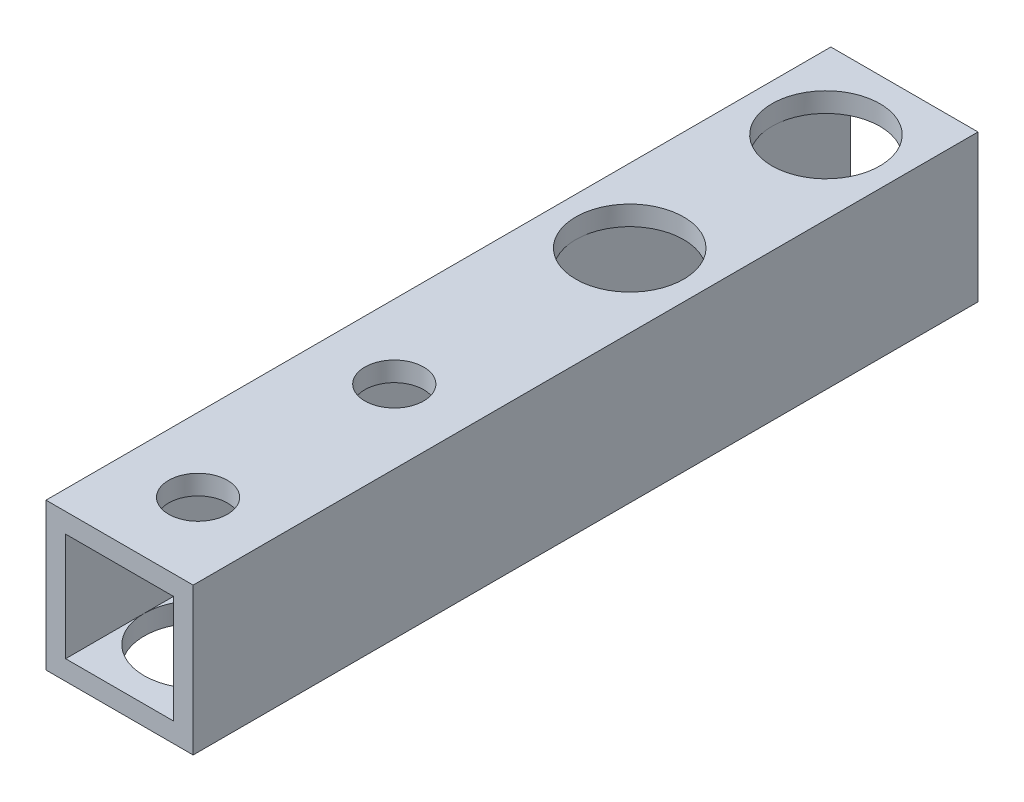
from build123d import *

# Parameters (mm, degrees)
ESQUISSE1_W             = 7.5
ESQUISSE1_H             = 7.5
ESQUISSE1_W_2           = 5.5
ESQUISSE1_H_2           = 5.5
BOSS_EXTRU_1_DEPTH      = 40
ESQUISSE2_R             = 1.5
ENL_V_MAT_EXTRU_1_DEPTH = 41.869456811
ESQUISSE3_R             = 2.75
ENL_V_MAT_EXTRU_2_DEPTH = 2
ESQUISSE4_R             = 2.75
ENL_V_MAT_EXTRU_3_DEPTH = 2


with BuildPart() as part:
    # Esquisse1 → Boss.-Extru.1 (new body)
    with BuildSketch(Plane.XY):
        Rectangle(ESQUISSE1_W, ESQUISSE1_H)
        Rectangle(ESQUISSE1_W_2, ESQUISSE1_H_2, mode=Mode.SUBTRACT)
    extrude(amount=BOSS_EXTRU_1_DEPTH)

    # Esquisse2 → Enlèv. mat.-Extru.1 (cut, through all)
    with BuildSketch(Plane(origin=(0, 3.75, 0), x_dir=(1, 0, 0), z_dir=(0, 1, 0))):
        with Locations((0, -4)):
            Circle(ESQUISSE2_R)
        with Locations((0, -14)):
            Circle(ESQUISSE2_R)
        with Locations((0, -26)):
            Circle(ESQUISSE2_R)
        with Locations((0, -36)):
            Circle(ESQUISSE2_R)
    extrude(amount=-ENL_V_MAT_EXTRU_1_DEPTH, mode=Mode.SUBTRACT)

    # Esquisse3 → Enlèv. mat.-Extru.2 (cut)
    with BuildSketch(Plane(origin=(0, 3.75, 0), x_dir=(1, 0, 0), z_dir=(0, 1, 0))):
        with Locations((0, -4)):
            Circle(ESQUISSE3_R)
        with Locations((0, -14)):
            Circle(ESQUISSE3_R)
    extrude(amount=-ENL_V_MAT_EXTRU_2_DEPTH, mode=Mode.SUBTRACT)

    # Esquisse4 → Enlèv. mat.-Extru.3 (cut)
    with BuildSketch(Plane.XZ.offset(3.75)):
        with Locations((0, 26)):
            Circle(ESQUISSE4_R)
        with Locations((0, 36)):
            Circle(ESQUISSE4_R)
    extrude(amount=-ENL_V_MAT_EXTRU_3_DEPTH, mode=Mode.SUBTRACT)


solid = part.part
